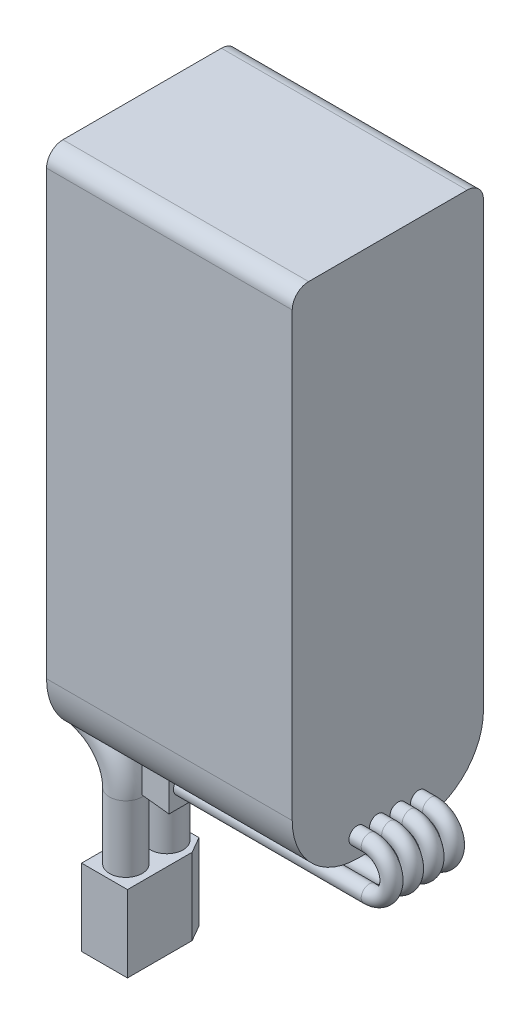
from build123d import *

# Parameters (mm, degrees)
SKETCH1_W           = 64
SKETCH1_H           = 30
BOSS_EXTRUDE1_DEPTH = 23.35
FILLET1_R           = 2
SKETCH2_R           = 2
SKETCH5_R           = 1
SKETCH7_W           = 4.6
SKETCH7_H           = 10.6
BOSS_EXTRUDE2_DEPTH = 3.5
BOSS_EXTRUDE2_TAPER = 3
BOSS_EXTRUDE3_DEPTH = 9.35
FILLET3_R           = 8


with BuildPart() as part:
    # Sketch1 → Boss-Extrude1 (new body)
    with BuildSketch(Plane(origin=(0, 0, 0), x_dir=(0, 1, 0), z_dir=(0, 0, 1))):
        Rectangle(SKETCH1_W, SKETCH1_H)
    extrude(amount=BOSS_EXTRUDE1_DEPTH)

    # Fillet1
    fillet1_edges = [part.edges().sort_by_distance(p)[0] for p in [
        (0, 32, 0),
        (0, 32, 23.35),
    ]]
    fillet(fillet1_edges, radius=FILLET1_R)

    # Sweep2: sweep along a path in Sketch4
    with BuildLine(Plane(origin=(0, 0, 0), x_dir=(0, 1, 0), z_dir=(0, 0, 1))) as sweep2_path:
        Line((-29, 15), (-29, 17.811482156))
        ThreePointArc((-29, 17.811482156), (-31.129819741, 20.333095361), (-33.97216907, 18.655085952))
        ThreePointArc((-33.97216907, 18.655085952), (-36.239159807, 15.640572518), (-39.83271041, 14.494739937))
        Line((-39.83271041, 14.494739937), (-47.929878258, 14.494739937))
    # Sketch2 → Sweep2 (sweep)
    with BuildSketch(Plane(origin=(-15, 0, 10), x_dir=(0, 0, -1), z_dir=(1, 0, 0))):
        with Locations((0.825, -29)):
            Circle(SKETCH2_R)
        with Locations((-4.175, -29)):
            Circle(SKETCH2_R)
    sweep(path=sweep2_path.line)

    # Sweep3: sweep along a path in Sketch6
    with BuildLine(Plane(origin=(0, 0, 0), x_dir=(0, 1, 0), z_dir=(0, 0, 1))) as sweep3_path:
        Line((-29.5, -15), (-29.5, -16.497724548))
        ThreePointArc((-29.5, -16.497724548), (-32.200025095, -19.197749643), (-34.900050191, -16.497724548))
        Line((-34.900050191, -16.497724548), (-34.900050191, 6.423160741))
    # Sketch5 → Sweep3 (sweep)
    with BuildSketch(Plane.YZ.offset(15)):
        with Locations((-29.5, 12.925)):
            Circle(SKETCH5_R)
        with Locations((-29.5, 10.425)):
            Circle(SKETCH5_R)
        with Locations((-29.5, 15.425)):
            Circle(SKETCH5_R)
        with Locations((-29.5, 7.925)):
            Circle(SKETCH5_R)
    sweep(path=sweep3_path.line)

    # Sketch7 → Boss-Extrude2 (add)
    with BuildSketch(Plane(origin=(-6.423160741, 0, 0), x_dir=(0, -1, 0), z_dir=(-1, 0, 0))):
        with Locations((34.900050191, 11.675)):
            Rectangle(SKETCH7_W, SKETCH7_H)
    extrude(amount=BOSS_EXTRUDE2_DEPTH, taper=BOSS_EXTRUDE2_TAPER)

    # Sketch8 → Boss-Extrude3 (add)
    with BuildSketch(Plane.XZ.offset(47.929878258)):
        Polygon((-16.35310297, 6.911630097), (-12.828061558, 6.911630097), (-11.694739937, 8.874600725), (-11.694739937, 16.775), (-17.294739937, 16.775), (-17.294739937, 8.542593166), align=None)
    extrude(amount=BOSS_EXTRUDE3_DEPTH)

    # Fillet3
    fillet3_edges = [part.edges().sort_by_distance(p)[0] for p in [
        (0, -32, 0),
        (0, -32, 23.35),
    ]]
    fillet(fillet3_edges, radius=FILLET3_R)


solid = part.part
